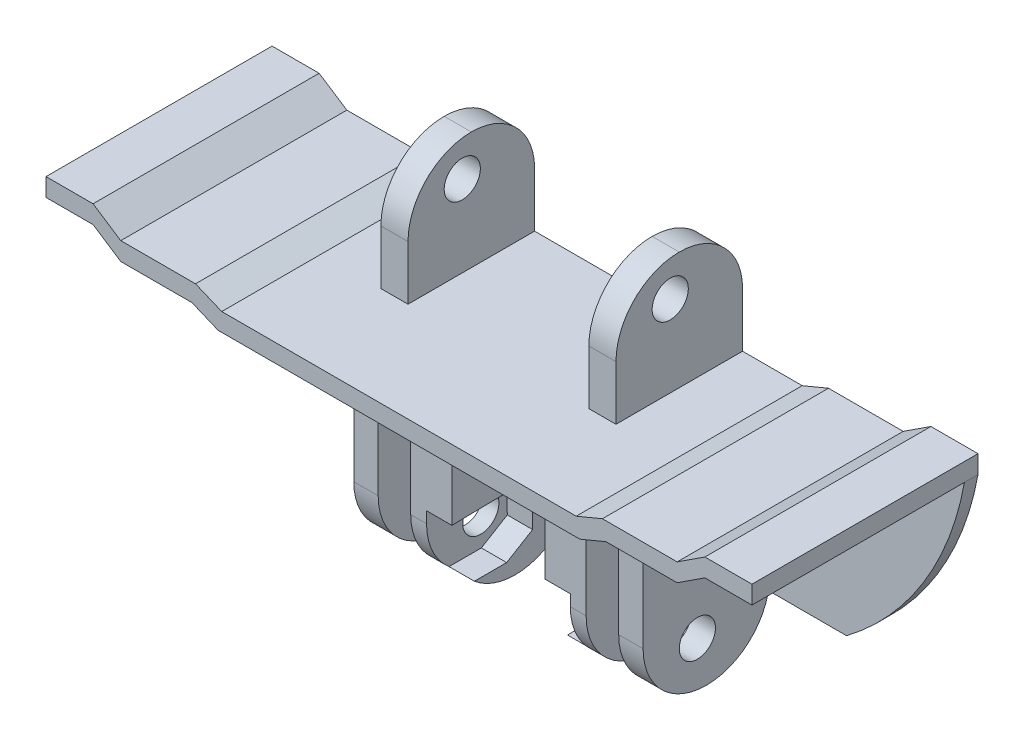
from build123d import *

# Parameters (mm, degrees)
SKETCH2_W                 = 5
SKETCH2_H                 = 25
BOSS_EXTRUDE1_DEPTH       = 14
BOSS_EXTRUDE1_2_DEPTH     = 14
BOSS_EXTRUDE3_DEPTH       = 25
SKETCH5_W                 = 3
SKETCH5_H                 = 13
BOSS_EXTRUDE4_DEPTH       = 14
SKETCH7_W                 = 3
SKETCH7_H                 = 25
BOSS_EXTRUDE5_DEPTH       = 14
SKETCH15_W                = 0.3
SKETCH15_H                = 14
CUT_EXTRUDE2_DEPTH        = 25
SKETCH16_W                = 0.15
SKETCH16_H                = 14
CUT_EXTRUDE3_DEPTH        = 25
FILLET1_R                 = 7
F_4_0MM_DOWEL_HOLE2_D     = 4
FILLET2_R                 = 7
F_4_0MM_DOWEL_HOLE1_D     = 4
F_4_0MM_DOWEL_HOLE1_DEPTH = 26
F_4_0MM_DOWEL_HOLE1_TIP   = 1.201721238
BOSS_EXTRUDE6_DEPTH       = 1.5
CUT_EXTRUDE4_START        = -2.8
SKETCH18_R                = 2
CUT_EXTRUDE4_DEPTH        = 2.8


with BuildPart() as part:
    # Sketch2 → Boss-Extrude1 (new body)
    with BuildSketch(Plane.XY):
        with Locations((-7.5, -6.5)):
            Rectangle(SKETCH2_W, SKETCH2_H)
    extrude(amount=BOSS_EXTRUDE1_DEPTH)



with BuildPart() as body_2:
    # Sketch2 → Boss-Extrude1 2 (new body)
    with BuildSketch(Plane.XY):
        with Locations((7.5, -6.5)):
            Rectangle(SKETCH2_W, SKETCH2_H)
    extrude(amount=BOSS_EXTRUDE1_2_DEPTH)


with BuildPart() as part_1:
    add(part.part)

    add(body_2.part)  # Boss-Extrude3 merges body 2
    # Sketch4 → Boss-Extrude3 (add)
    with BuildSketch(Plane.XY):
        Polygon((-26, 9.206366686), (-30.765993712, 9.206366686), (-33.831204342, 11.206366686), (-39.037863495, 11.206366686), (-39.037863495, 9.206366686), (-33.831204342, 9.206366686), (-30.765993712, 7.206366686), (-26, 7.206366686), align=None)
        Polygon((22.901603942, 7.206366686), (26, 7.206366686), (26, 9.206366686), (22.502408858, 9.206366686), (19.600804916, 8), (10, 8), (-10, 8), (-19.600804916, 8), (-22.502408858, 9.206366686), (-26, 9.206366686), (-26, 7.206366686), (-22.901603942, 7.206366686), (-20, 6), (-10, 6), (10, 6), (20, 6), align=None)
        Polygon((26, 7.206366686), (26, 9.206366686), (30.765993712, 9.206366686), (33.831204342, 11.206366686), (39.037863495, 11.206366686), (39.037863495, 9.206366686), (33.831204342, 9.206366686), (30.765993712, 7.206366686), align=None)
    extrude(amount=BOSS_EXTRUDE3_DEPTH)

    # Sketch5 → Boss-Extrude4 (add)
    with BuildSketch(Plane.XY):
        with Locations((-11.5, 14.5)):
            Rectangle(SKETCH5_W, SKETCH5_H)
        with Locations((11.5, 14.5)):
            Rectangle(SKETCH5_W, SKETCH5_H)
    extrude(amount=BOSS_EXTRUDE4_DEPTH)

    # Sketch7 → Boss-Extrude5 (add)
    with BuildSketch(Plane.XY):
        with Locations((-14.5, -6.5)):
            Rectangle(SKETCH7_W, SKETCH7_H)
        with Locations((14.5, -6.5)):
            Rectangle(SKETCH7_W, SKETCH7_H)
    extrude(amount=BOSS_EXTRUDE5_DEPTH)

    # Sketch15 → Cut-Extrude2 (cut)
    with BuildSketch(Plane.XZ.offset(19)):
        with Locations((-9.85, 7)):
            Rectangle(SKETCH15_W, SKETCH15_H)
        with Locations((9.85, 7)):
            Rectangle(SKETCH15_W, SKETCH15_H)
        with Locations((-13.15, 7)):
            Rectangle(SKETCH15_W, SKETCH15_H)
        with Locations((13.15, 7)):
            Rectangle(SKETCH15_W, SKETCH15_H)
    extrude(amount=-CUT_EXTRUDE2_DEPTH, mode=Mode.SUBTRACT)

    # Sketch16 → Cut-Extrude3 (cut)
    with BuildSketch(Plane.XZ.offset(19)):
        with Locations((-5.075, 7)):
            Rectangle(SKETCH16_W, SKETCH16_H)
        with Locations((5.075, 7)):
            Rectangle(SKETCH16_W, SKETCH16_H)
    extrude(amount=-CUT_EXTRUDE3_DEPTH, mode=Mode.SUBTRACT)

    # Fillet1
    fillet1_edges = [part_1.edges().sort_by_distance(p)[0] for p in [
        (7.425, -19, 14),
        (7.425, -19, 0),
        (-7.425, -19, 0),
        (-7.425, -19, 14),
        (-14.65, -19, 0),
        (-14.65, -19, 14),
        (14.65, -19, 14),
        (14.65, -19, 0),
    ]]
    fillet(fillet1_edges, radius=FILLET1_R - 0.0001)  # a hair under: the kernel refuses the full size

    # Ø4.0mm Dowel Hole2 (through all)
    with Locations(Plane(origin=(16, 0, 0), x_dir=(0, 0, -1), z_dir=(1, 0, 0))):
        with Locations((-8, -14)):
            Hole(F_4_0MM_DOWEL_HOLE2_D / 2)

    # Fillet2
    fillet2_edges = [part_1.edges().sort_by_distance(p)[0] for p in [
        (-11.5, 21, 0),
        (-11.5, 21, 14),
        (11.5, 21, 0),
        (11.5, 21, 14),
    ]]
    fillet(fillet2_edges, radius=FILLET2_R - 0.0001)  # a hair under: the kernel refuses the full size

    # Ø4.0mm Dowel Hole1
    with Locations(Plane(origin=(13, 0, 0), x_dir=(0, 0, -1), z_dir=(1, 0, 0))):
        with Locations((-8, 17)):
            Hole(F_4_0MM_DOWEL_HOLE1_D / 2, depth=F_4_0MM_DOWEL_HOLE1_DEPTH)
            with Locations((0, 0, -(F_4_0MM_DOWEL_HOLE1_DEPTH + F_4_0MM_DOWEL_HOLE1_TIP / 2))):  # 118° drill point
                Cone(0, F_4_0MM_DOWEL_HOLE1_D / 2, F_4_0MM_DOWEL_HOLE1_TIP, mode=Mode.SUBTRACT)

    # Sketch14 → Boss-Extrude6 (add)
    with BuildSketch(Plane.XY):
        with BuildLine():
            Line((-22.901603942, 7.206366686), (-30.765993712, 7.206366686))
            Line((-30.765993712, 7.206366686), (-33.831204342, 9.206366686))
            Line((-33.831204342, 9.206366686), (-39.037863495, 9.206366686))
            ThreePointArc((-39.037863495, 9.206366686), (-34.518223809, -2.625999259), (-26, -12))
            Line((-26, -12), (-16, -12))
            Line((-16, -12), (-16, 6))
            Line((-16, 6), (-20, 6))
            Line((-20, 6), (-22.901603942, 7.206366686))
        make_face()
        with BuildLine():
            Line((20, 6), (16, 6))
            Line((16, 6), (16, -12))
            Line((16, -12), (26, -12))
            ThreePointArc((26, -12), (34.518223809, -2.625999259), (39.037863495, 9.206366686))
            Line((39.037863495, 9.206366686), (33.831204342, 9.206366686))
            Line((33.831204342, 9.206366686), (30.765993712, 7.206366686))
            Line((30.765993712, 7.206366686), (22.901603942, 7.206366686))
            Line((22.901603942, 7.206366686), (20, 6))
        make_face()
    extrude(amount=BOSS_EXTRUDE6_DEPTH)

    # Sketch18 → Cut-Extrude4 (cut)
    # profile 1 of 3: a face of its own
    with BuildSketch(Plane(origin=(-5.15, 0, 0), x_dir=(0, 0, -1), z_dir=(1, 0, 0)).offset(CUT_EXTRUDE4_START)):
        Polygon((-7.940827202, -17.348108707), (-5.070866406, -15.622809207), (-5.130039204, -12.2747005), (-8.059172798, -10.651891293), (-10.929133594, -12.377190793), (-10.869960796, -15.7252995), align=None)
        with Locations((-8, -14)):
            Circle(SKETCH18_R, mode=Mode.SUBTRACT)
    # profile 2 of 3: a face of its own
    with BuildSketch(Plane(origin=(-5.15, 0, 0), x_dir=(0, 0, -1), z_dir=(1, 0, 0)).offset(CUT_EXTRUDE4_START)):
        with BuildLine():
            Line((-22.212279743, -17.348108707), (-11.516384977, -17.348108707))
            ThreePointArc((-11.516384977, -17.348108707), (-13.348806771, -14.948330474), (-14, -12))
            Line((-14, -12), (-14, -10.7568865))
            Line((-14, -10.7568865), (-22.212279743, -10.902026223))
            Line((-22.212279743, -10.902026223), (-22.212279743, -17.348108707))
        make_face()
    # profile 3 of 3: a face of its own
    with BuildSketch(Plane(origin=(-5.15, 0, 0), x_dir=(0, 0, -1), z_dir=(1, 0, 0)).offset(CUT_EXTRUDE4_START)):
        with BuildLine():
            Line((-11.516384977, -17.348108707), (-7.940827202, -17.348108707))
            Line((-7.940827202, -17.348108707), (-10.869960796, -15.7252995))
            Line((-10.869960796, -15.7252995), (-10.929133594, -12.377190793))
            Line((-10.929133594, -12.377190793), (-8.059172798, -10.651891293))
            Line((-8.059172798, -10.651891293), (-14, -10.7568865))
            Line((-14, -10.7568865), (-14, -12))
            ThreePointArc((-14, -12), (-13.348806771, -14.948330474), (-11.516384977, -17.348108707))
        make_face()
    cut_extrude4 = extrude(amount=CUT_EXTRUDE4_DEPTH, mode=Mode.SUBTRACT)

    # Mirror1: Cut-Extrude4 across plane
    add(cut_extrude4.mirror(Plane(origin=(0, 0, 0), x_dir=(0, 0, 1), z_dir=(1, 0, 0))), mode=Mode.SUBTRACT)


solid = part_1.part
